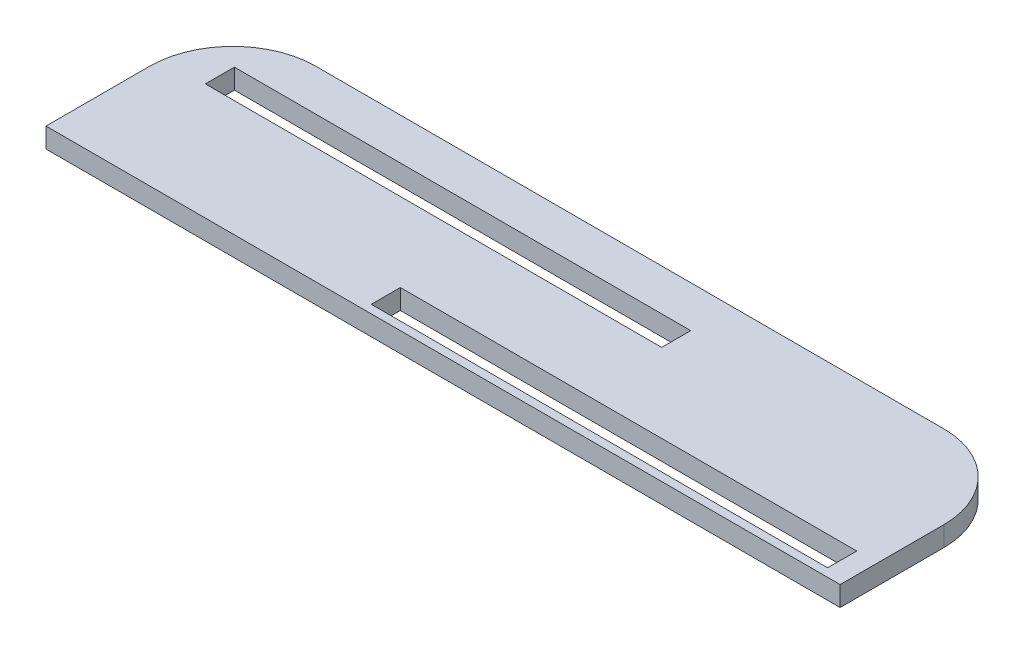
from build123d import *

# Parameters (mm, degrees)
SKETCH1_W           = 9.57
SKETCH1_H           = 2.25
SKETCH1_W_2         = 5.5
SKETCH1_H_2         = 0.35
BOSS_EXTRUDE1_DEPTH = 0.24
FILLET1_R           = 1


with BuildPart() as part:
    # Sketch1 → Boss-Extrude1 (new body)
    with BuildSketch(Plane(origin=(0, 0, 0), x_dir=(1, 0, 0), z_dir=(0, 1, 0))):
        with Locations((4.785, 1.125)):
            Rectangle(SKETCH1_W, SKETCH1_H)
        with Locations((3.27, 1.575)):
            Rectangle(SKETCH1_W_2, SKETCH1_H_2, mode=Mode.SUBTRACT)
        with Locations((6.57, 0.275)):
            Rectangle(SKETCH1_W_2, SKETCH1_H_2, mode=Mode.SUBTRACT)
    extrude(amount=BOSS_EXTRUDE1_DEPTH)

    # Fillet1
    fillet1_edges = [part.edges().sort_by_distance(p)[0] for p in [
        (9.57, 0.12, -2.25),
        (0, 0.12, -2.25),
    ]]
    fillet(fillet1_edges, radius=FILLET1_R)


solid = part.part
